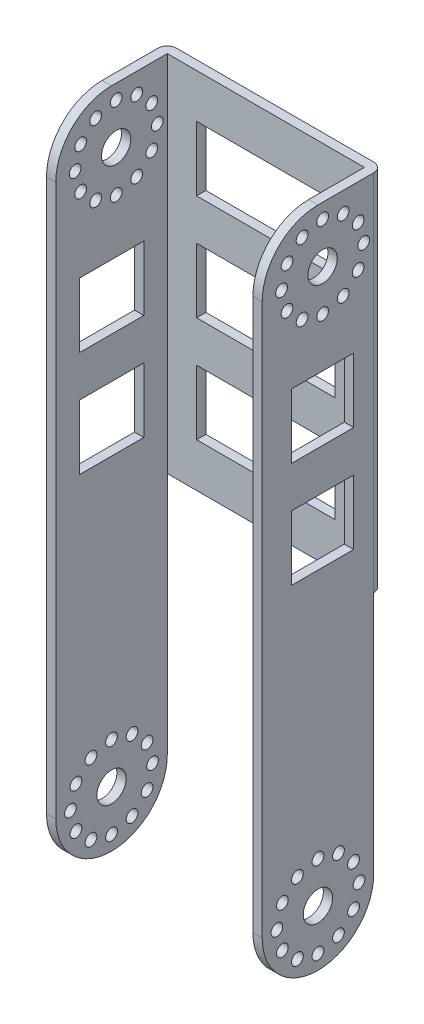
from build123d import *

# Parameters (mm, degrees)
ESQUISSE2_W        = 33.6
ESQUISSE2_H        = 62
ESQUISSE2_W_2      = 23.6
ESQUISSE2_H_2      = 11
BOSS_EXTRU_1_DEPTH = 1.5875
ESQUISSE3_R        = 2.5
ESQUISSE3_R_2      = 1
ESQUISSE3_W        = 10.5875
ESQUISSE3_H        = 11
BOSS_EXTRU_2_DEPTH = 1.5875
CONG_3_R           = 1.5875
CONG_4_R           = 9.5
ESQUISSE4_R        = 2.5
ESQUISSE4_R_2      = 1
ESQUISSE4_W        = 11.003569346
ESQUISSE4_H        = 11
BOSS_EXTRU_3_DEPTH = 1.5875
CONG_6_R           = 1.5875
CONG_7_R           = 9.5


with BuildPart() as part:
    # Esquisse2 → Boss.-Extru.1 (new body)
    with BuildSketch(Plane.XY):
        Rectangle(ESQUISSE2_W, ESQUISSE2_H)
        Rectangle(ESQUISSE2_W_2, ESQUISSE2_H_2, mode=Mode.SUBTRACT)
        with Locations((0, 18)):
            Rectangle(ESQUISSE2_W_2, ESQUISSE2_H_2, mode=Mode.SUBTRACT)
        with Locations((0, -18)):
            Rectangle(ESQUISSE2_W_2, ESQUISSE2_H_2, mode=Mode.SUBTRACT)
    extrude(amount=BOSS_EXTRU_1_DEPTH)


with BuildPart() as body_2:
    # Esquisse3 → Boss.-Extru.2 (new body)
    with BuildSketch(Plane(origin=(16.8, 0, 0), x_dir=(0, 0, -1), z_dir=(1, 0, 0))):
        with BuildLine():
            Line((-20.5875, 31), (0, 31))
            Line((0, 31), (0, -31))
            Line((0, -31), (-1.5875, -31))
            Line((-1.5875, -31), (-1.5875, -72.5))
            ThreePointArc((-1.5875, -72.5), (-11.0875, -82), (-20.5875, -72.5))
            Line((-20.5875, -72.5), (-20.5875, -31))
            Line((-20.5875, -31), (-20.5875, 31))
        make_face()
        with Locations((-11.0875, -72.5)):
            Circle(ESQUISSE3_R, mode=Mode.SUBTRACT)
        with Locations((-11.0875, -79.5)):
            Circle(ESQUISSE3_R_2, mode=Mode.SUBTRACT)
        with Locations((-14.5875, -78.562177826)):
            Circle(ESQUISSE3_R_2, mode=Mode.SUBTRACT)
        with Locations((-17.149677826, -76)):
            Circle(ESQUISSE3_R_2, mode=Mode.SUBTRACT)
        with Locations((-18.0875, -72.5)):
            Circle(ESQUISSE3_R_2, mode=Mode.SUBTRACT)
        with Locations((-17.149677826, -69)):
            Circle(ESQUISSE3_R_2, mode=Mode.SUBTRACT)
        with Locations((-14.5875, -66.437822174)):
            Circle(ESQUISSE3_R_2, mode=Mode.SUBTRACT)
        with Locations((-11.0875, -65.5)):
            Circle(ESQUISSE3_R_2, mode=Mode.SUBTRACT)
        with Locations((-7.5875, -66.437822174)):
            Circle(ESQUISSE3_R_2, mode=Mode.SUBTRACT)
        with Locations((-5.025322174, -69)):
            Circle(ESQUISSE3_R_2, mode=Mode.SUBTRACT)
        with Locations((-4.0875, -72.5)):
            Circle(ESQUISSE3_R_2, mode=Mode.SUBTRACT)
        with Locations((-5.025322174, -76)):
            Circle(ESQUISSE3_R_2, mode=Mode.SUBTRACT)
        with Locations((-7.5875, -78.562177826)):
            Circle(ESQUISSE3_R_2, mode=Mode.SUBTRACT)
        with Locations((-10.29375, 21.5)):
            Circle(ESQUISSE3_R, mode=Mode.SUBTRACT)
        with Locations((-10.29375, 28.5)):
            Circle(ESQUISSE3_R_2, mode=Mode.SUBTRACT)
        with Locations((-6.79375, 27.562177826)):
            Circle(ESQUISSE3_R_2, mode=Mode.SUBTRACT)
        with Locations((-4.231572174, 25)):
            Circle(ESQUISSE3_R_2, mode=Mode.SUBTRACT)
        with Locations((-3.29375, 21.5)):
            Circle(ESQUISSE3_R_2, mode=Mode.SUBTRACT)
        with Locations((-4.231572174, 18)):
            Circle(ESQUISSE3_R_2, mode=Mode.SUBTRACT)
        with Locations((-6.79375, 15.437822174)):
            Circle(ESQUISSE3_R_2, mode=Mode.SUBTRACT)
        with Locations((-10.29375, 14.5)):
            Circle(ESQUISSE3_R_2, mode=Mode.SUBTRACT)
        with Locations((-13.79375, 15.437822174)):
            Circle(ESQUISSE3_R_2, mode=Mode.SUBTRACT)
        with Locations((-16.355927826, 18)):
            Circle(ESQUISSE3_R_2, mode=Mode.SUBTRACT)
        with Locations((-17.29375, 21.5)):
            Circle(ESQUISSE3_R_2, mode=Mode.SUBTRACT)
        with Locations((-16.355927826, 25)):
            Circle(ESQUISSE3_R_2, mode=Mode.SUBTRACT)
        with Locations((-13.79375, 27.562177826)):
            Circle(ESQUISSE3_R_2, mode=Mode.SUBTRACT)
        with Locations((-10.29375, 0.597470968)):
            Rectangle(ESQUISSE3_W, ESQUISSE3_H, mode=Mode.SUBTRACT)
        with Locations((-10.29375, -17.402529032)):
            Rectangle(ESQUISSE3_W, ESQUISSE3_H, mode=Mode.SUBTRACT)
    extrude(amount=BOSS_EXTRU_2_DEPTH)

    # Congé3
    cong_3_edges = [body_2.edges().sort_by_distance(p)[0] for p in [
        (18.3875, 0, 0),
    ]]
    fillet(cong_3_edges, radius=CONG_3_R - 0.0001)  # a hair under: the kernel refuses the full size

    # Congé4
    cong_4_edges = [body_2.edges().sort_by_distance(p)[0] for p in [
        (17.59375, 31, 20.5875),
    ]]
    fillet(cong_4_edges, radius=CONG_4_R)

    # Intersect1: read off the stored shape, not the designer's step
    # Intersect1: union part
    add(part.part)

    # Esquisse4 → Boss.-Extru.3 (add)
    with BuildSketch(Plane.ZY.offset(16.8)):
        with BuildLine():
            Line((1.5875, 31), (0, 31))
            Line((0, 31), (0, -31))
            Line((0, -31), (1.5875, -31))
            Line((1.5875, -31), (1.5875, -72.5))
            ThreePointArc((1.5875, -72.5), (11.0875, -82), (20.5875, -72.5))
            Line((20.5875, -72.5), (20.5875, 31))
            Line((20.5875, 31), (1.5875, 31))
        make_face()
        with Locations(Location((11.0875, -72.5, 0), (0, 0, 180))):
            Circle(ESQUISSE4_R, mode=Mode.SUBTRACT)
        with Locations(Location((11.0875, -79.5, 0), (0, 0, 180))):
            Circle(ESQUISSE4_R_2, mode=Mode.SUBTRACT)
        with Locations(Location((7.5875, -78.562177826, 0), (0, 0, 180))):
            Circle(ESQUISSE4_R_2, mode=Mode.SUBTRACT)
        with Locations(Location((5.025322174, -76, 0), (0, 0, 180))):
            Circle(ESQUISSE4_R_2, mode=Mode.SUBTRACT)
        with Locations(Location((4.0875, -72.5, 0), (0, 0, 180))):
            Circle(ESQUISSE4_R_2, mode=Mode.SUBTRACT)
        with Locations(Location((5.025322174, -69, 0), (0, 0, 180))):
            Circle(ESQUISSE4_R_2, mode=Mode.SUBTRACT)
        with Locations(Location((7.5875, -66.437822174, 0), (0, 0, 180))):
            Circle(ESQUISSE4_R_2, mode=Mode.SUBTRACT)
        with Locations(Location((11.0875, -65.5, 0), (0, 0, 180))):
            Circle(ESQUISSE4_R_2, mode=Mode.SUBTRACT)
        with Locations(Location((14.5875, -66.437822174, 0), (0, 0, 180))):
            Circle(ESQUISSE4_R_2, mode=Mode.SUBTRACT)
        with Locations(Location((17.149677826, -69, 0), (0, 0, 180))):
            Circle(ESQUISSE4_R_2, mode=Mode.SUBTRACT)
        with Locations(Location((18.0875, -72.5, 0), (0, 0, 180))):
            Circle(ESQUISSE4_R_2, mode=Mode.SUBTRACT)
        with Locations(Location((17.149677826, -76, 0), (0, 0, 180))):
            Circle(ESQUISSE4_R_2, mode=Mode.SUBTRACT)
        with Locations(Location((14.5875, -78.562177826, 0), (0, 0, 180))):
            Circle(ESQUISSE4_R_2, mode=Mode.SUBTRACT)
        with Locations(Location((10.29375, 21.5, 0), (0, 0, 180))):
            Circle(ESQUISSE4_R, mode=Mode.SUBTRACT)
        with Locations(Location((6.79375, 15.437822174, 0), (0, 0, 180))):
            Circle(ESQUISSE4_R_2, mode=Mode.SUBTRACT)
        with Locations(Location((4.231572174, 18, 0), (0, 0, 180))):
            Circle(ESQUISSE4_R_2, mode=Mode.SUBTRACT)
        with Locations(Location((10.29375, 14.5, 0), (0, 0, 180))):
            Circle(ESQUISSE4_R_2, mode=Mode.SUBTRACT)
        with Locations(Location((3.29375, 21.5, 0), (0, 0, 180))):
            Circle(ESQUISSE4_R_2, mode=Mode.SUBTRACT)
        with Locations(Location((4.231572174, 25, 0), (0, 0, 180))):
            Circle(ESQUISSE4_R_2, mode=Mode.SUBTRACT)
        with Locations(Location((6.79375, 27.562177826, 0), (0, 0, 180))):
            Circle(ESQUISSE4_R_2, mode=Mode.SUBTRACT)
        with Locations(Location((10.29375, 28.5, 0), (0, 0, 180))):
            Circle(ESQUISSE4_R_2, mode=Mode.SUBTRACT)
        with Locations(Location((13.79375, 27.562177826, 0), (0, 0, 180))):
            Circle(ESQUISSE4_R_2, mode=Mode.SUBTRACT)
        with Locations(Location((16.355927826, 25, 0), (0, 0, 180))):
            Circle(ESQUISSE4_R_2, mode=Mode.SUBTRACT)
        with Locations(Location((17.29375, 21.5, 0), (0, 0, 180))):
            Circle(ESQUISSE4_R_2, mode=Mode.SUBTRACT)
        with Locations(Location((16.355927826, 18, 0), (0, 0, 180))):
            Circle(ESQUISSE4_R_2, mode=Mode.SUBTRACT)
        with Locations(Location((13.79375, 15.437822174, 0), (0, 0, 180))):
            Circle(ESQUISSE4_R_2, mode=Mode.SUBTRACT)
        with Locations((11.085715327, -0.168943848)):
            Rectangle(ESQUISSE4_W, ESQUISSE4_H, mode=Mode.SUBTRACT)
        with Locations((11.085715327, -18.168943848)):
            Rectangle(ESQUISSE4_W, ESQUISSE4_H, mode=Mode.SUBTRACT)
    extrude(amount=BOSS_EXTRU_3_DEPTH)

    # Congé6
    cong_6_edges = [body_2.edges().sort_by_distance(p)[0] for p in [
        (-18.3875, 0, 0),
    ]]
    fillet(cong_6_edges, radius=CONG_6_R)

    # Congé7
    cong_7_edges = [body_2.edges().sort_by_distance(p)[0] for p in [
        (-17.59375, 31, 20.5875),
    ]]
    fillet(cong_7_edges, radius=CONG_7_R)


solid = body_2.part
